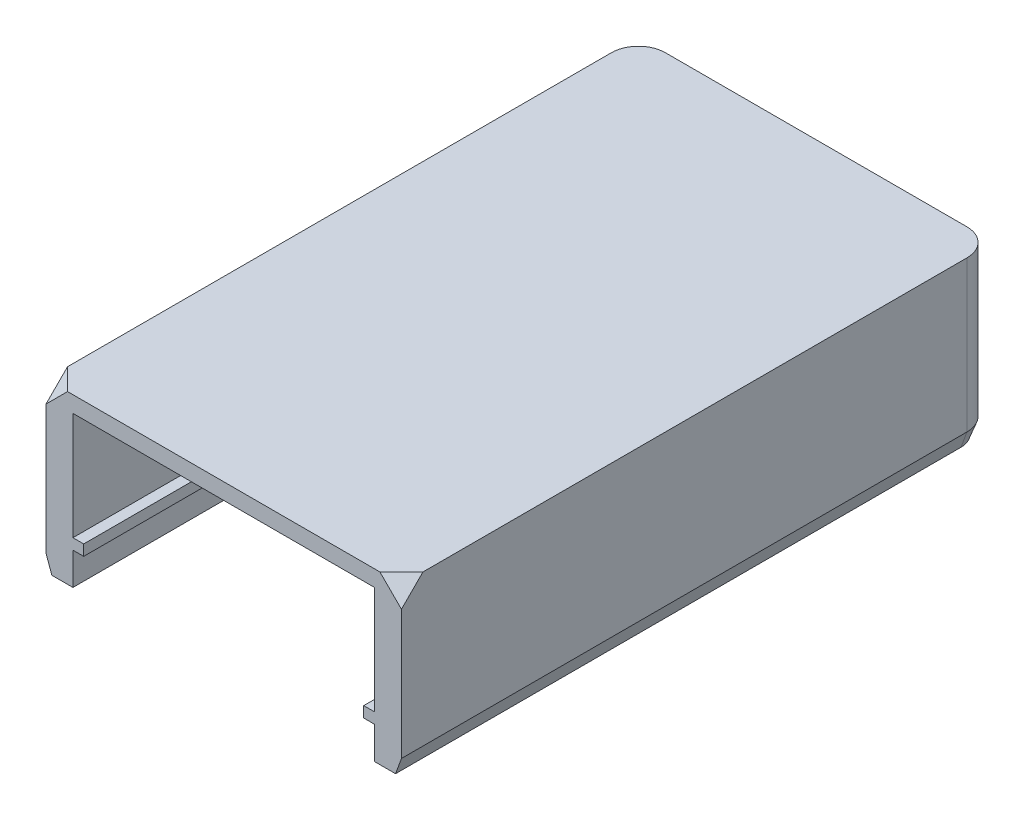
from build123d import *
from OCP.BRepFilletAPI import BRepFilletAPI_MakeChamfer

# Parameters (mm, degrees)
CROQUIS1_W              = 66
CROQUIS1_H              = 110
SALIENTE_EXTRUIR1_DEPTH = 3
SALIENTE_EXTRUIR2_DEPTH = 28
CROQUIS3_W              = 107
CROQUIS3_H              = 2
SALIENTE_EXTRUIR3_DEPTH = 2
REDONDEO1_R             = 5
CHAFL_N1_SIZE           = 3
CHAFL_N1_SIZE2          = 1.091910703
CHAFL_N2_START          = -54
CHAFL_N2_OUTLINE_W      = 7
CHAFL_N2_OUTLINE_H      = 9
CHAFL_N2_DEPTH          = 3.770526581
CHAFL_N3_START          = 50.229473419
CHAFL_N3_OUTLINE_W      = 8
CHAFL_N3_OUTLINE_H      = 9
CHAFL_N3_DEPTH          = 3.770526581


with BuildPart() as part:
    # Croquis1 → Saliente-Extruir1 (new body)
    with BuildSketch(Plane(origin=(0, 0, 0), x_dir=(1, 0, 0), z_dir=(0, 1, 0))):
        Rectangle(CROQUIS1_W, CROQUIS1_H)
    extrude(amount=SALIENTE_EXTRUIR1_DEPTH)

    # Croquis2 → Saliente-Extruir2 (add)
    with BuildSketch(Plane.XZ):
        Polygon((-28, 55), (-33, 55), (-33, -49.5), (-33, -55), (-28, -55), (28, -55), (33, -55), (33, -52), (33, 55), (28, 55), (28, -52), (-28, -52), align=None)
    extrude(amount=SALIENTE_EXTRUIR2_DEPTH)

    # Croquis3 → Saliente-Extruir3 (add)
    with BuildSketch(Plane(origin=(-28, 0, 0), x_dir=(0, 0, -1), z_dir=(1, 0, 0))):
        with Locations((-1.5, -21)):
            Rectangle(CROQUIS3_W, CROQUIS3_H)
    saliente_extruir3 = extrude(amount=SALIENTE_EXTRUIR3_DEPTH)

    # Simetría1: Saliente-Extruir3 across plane
    add(saliente_extruir3.mirror(Plane(origin=(0, 0, 0), x_dir=(0, 0, 1), z_dir=(1, 0, 0))))

    # Redondeo1
    redondeo1_edges = [part.edges().sort_by_distance(p)[0] for p in [
        (-33, -12.5, -55),
        (33, -12.5, -55),
    ]]
    fillet(redondeo1_edges, radius=REDONDEO1_R)

    # Chaflán1: one chamfer whose edges measure the first distance from different faces: ONE call of the kernel's chamfer builder (chamfer() names one face for all edges)
    chafl_n1_edges_1 = [part.edges().sort_by_distance(p)[0] for p in [
        (-33, -28, 2.5),
    ]]
    chafl_n1_side_1 = [part.faces().sort_by_distance(p)[0] for p in [
        (-33, -12.5, 2.5),
    ]]
    chafl_n1_edges_2 = [part.edges().sort_by_distance(p)[0] for p in [
        (0, -28, -55),
    ]]
    chafl_n1_side_2 = [part.faces().sort_by_distance(p)[0] for p in [
        (0, -12.5, -55),
    ]]
    chafl_n1_edges_3 = [part.edges().sort_by_distance(p)[0] for p in [
        (33, -28, 2.5),
    ]]
    chafl_n1_side_3 = [part.faces().sort_by_distance(p)[0] for p in [
        (33, -12.5, 2.5),
    ]]
    chafl_n1_edges_4 = [part.edges().sort_by_distance(p)[0] for p in [
        (31.535533906, -28, -53.535533906),
    ]]
    chafl_n1_side_4 = [part.faces().sort_by_distance(p)[0] for p in [
        (31.535533906, -12.5, -53.535533906),
    ]]
    chafl_n1_edges_5 = [part.edges().sort_by_distance(p)[0] for p in [
        (-31.535533906, -28, -53.535533906),
    ]]
    chafl_n1_side_5 = [part.faces().sort_by_distance(p)[0] for p in [
        (-31.535533906, -12.5, -53.535533906),
    ]]
    chafl_n1 = BRepFilletAPI_MakeChamfer(part.part.solid().wrapped)
    for e in chafl_n1_edges_1:
        chafl_n1.Add(CHAFL_N1_SIZE, CHAFL_N1_SIZE2, e.wrapped, chafl_n1_side_1[0].wrapped)  # the first distance lies on this face
    for e in chafl_n1_edges_2:
        chafl_n1.Add(CHAFL_N1_SIZE, CHAFL_N1_SIZE2, e.wrapped, chafl_n1_side_2[0].wrapped)  # the first distance lies on this face
    for e in chafl_n1_edges_3:
        chafl_n1.Add(CHAFL_N1_SIZE, CHAFL_N1_SIZE2, e.wrapped, chafl_n1_side_3[0].wrapped)  # the first distance lies on this face
    for e in chafl_n1_edges_4:
        chafl_n1.Add(CHAFL_N1_SIZE, CHAFL_N1_SIZE2, e.wrapped, chafl_n1_side_4[0].wrapped)  # the first distance lies on this face
    for e in chafl_n1_edges_5:
        chafl_n1.Add(CHAFL_N1_SIZE, CHAFL_N1_SIZE2, e.wrapped, chafl_n1_side_5[0].wrapped)  # the first distance lies on this face
    add(Compound.cast(chafl_n1.Shape()), mode=Mode.REPLACE)

    # Chaflán2: read off the stored shape, not the designer's step
    # Chaflán2 outline → Chaflán2 (cut)
    with BuildSketch(Plane(origin=(0, 0, 0), x_dir=(0.8164965809277258, 0.40824829046386313, 0.40824829046386313), z_dir=(0.5773502691896258, -0.5773502691896258, -0.5773502691896258)).offset(CHAFL_N2_START)):
        with Locations((-2.5, 36.5)):
            Rectangle(CHAFL_N2_OUTLINE_W, CHAFL_N2_OUTLINE_H)
    extrude(amount=CHAFL_N2_DEPTH, mode=Mode.SUBTRACT)

    # Chaflán3: read off the stored shape, not the designer's step
    # Chaflán3 outline → Chaflán3 (cut)
    with BuildSketch(Plane(origin=(0, 0, 0), x_dir=(0.8164965809277258, -0.40824829046386313, -0.40824829046386313), z_dir=(0.5773502691896258, 0.5773502691896258, 0.5773502691896258)).offset(CHAFL_N3_START)):
        with Locations((2, -36.5)):
            Rectangle(CHAFL_N3_OUTLINE_W, CHAFL_N3_OUTLINE_H)
    extrude(amount=CHAFL_N3_DEPTH, mode=Mode.SUBTRACT)


solid = part.part
